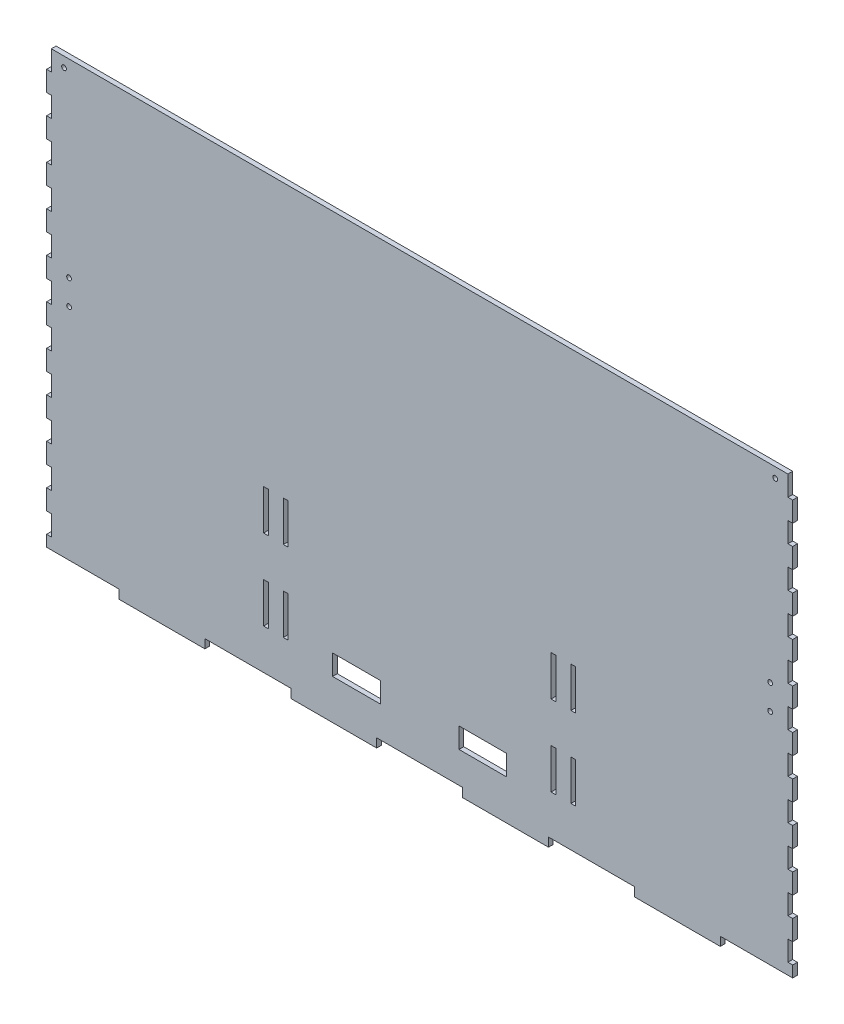
from build123d import *

# Parameters (mm, degrees)
SKETCH1_W                  = 2.9972
SKETCH1_H                  = 12.7
MAIN_EXTRUDE_DEPTH         = 2.9972
SKETCH8_R                  = 1.5
SKETCH8_W                  = 3.175
SKETCH8_H                  = 31.877
MOUNT_HOLES_DEPTH          = 430.751129385
SKETCH5_W                  = 2.9972
SKETCH5_H                  = 25.4
DOOR_GUIDE_SLOTS_DEPTH     = 430.751129385
SKETCH7_W                  = 30.1
SKETCH7_H                  = 12.85
LEVER_HOLES_DEPTH          = 430.751129385
SKETCH12_R                 = 1.5
EXTENSION_CLIP_HOLES_DEPTH = 430.751129385
EXTENSION_CENTER_CUT_DEPTH = 430.751129385


with BuildPart() as part:
    # Sketch1 → Main Extrude (new body)
    with BuildSketch(Plane.XY):
        Polygon((-380.8222, 139.7), (-406.4, 139.7), (-406.4, -139.7), (-352.213333333, -139.7), (-352.213333333, -134.112), (-298.026666667, -134.112), (-298.026666667, -139.7), (-243.84, -139.7), (-243.84, -134.112), (-189.653333333, -134.112), (-189.653333333, -139.7), (-135.466666667, -139.7), (-135.466666667, -134.112), (-81.28, -134.112), (-81.28, -139.7), (-27.093333333, -139.7), (-27.093333333, -134.112), (27.093333333, -134.112), (27.093333333, -139.7), (81.28, -139.7), (81.28, -134.112), (135.466666667, -134.112), (135.466666667, -139.7), (189.653333333, -139.7), (189.653333333, -134.112), (243.84, -134.112), (243.84, -139.7), (298.026666667, -139.7), (298.026666667, -134.112), (352.213333333, -134.112), (352.213333333, -139.7), (406.4, -139.7), (406.4, 139.7), (380.8222, 139.7), (380.8222, 127), (377.825, 127), (377.825, 139.7), (-377.825, 139.7), (-377.825, 127), (-380.8222, 127), align=None)
        with Locations((-379.3236, 107.95)):
            Rectangle(SKETCH1_W, SKETCH1_H, mode=Mode.SUBTRACT)
        with Locations((-379.3236, 82.55)):
            Rectangle(SKETCH1_W, SKETCH1_H, mode=Mode.SUBTRACT)
        with Locations((-379.3236, 57.15)):
            Rectangle(SKETCH1_W, SKETCH1_H, mode=Mode.SUBTRACT)
        with Locations((-379.3236, 31.75)):
            Rectangle(SKETCH1_W, SKETCH1_H, mode=Mode.SUBTRACT)
        with Locations((-379.3236, 6.35)):
            Rectangle(SKETCH1_W, SKETCH1_H, mode=Mode.SUBTRACT)
        with Locations((-379.3236, -19.05)):
            Rectangle(SKETCH1_W, SKETCH1_H, mode=Mode.SUBTRACT)
        with Locations((-379.3236, -44.45)):
            Rectangle(SKETCH1_W, SKETCH1_H, mode=Mode.SUBTRACT)
        with Locations((-379.3236, -69.85)):
            Rectangle(SKETCH1_W, SKETCH1_H, mode=Mode.SUBTRACT)
        with Locations((-379.3236, -95.25)):
            Rectangle(SKETCH1_W, SKETCH1_H, mode=Mode.SUBTRACT)
        with Locations((-379.3236, -120.65)):
            Rectangle(SKETCH1_W, SKETCH1_H, mode=Mode.SUBTRACT)
        with Locations((379.3236, 107.95)):
            Rectangle(SKETCH1_W, SKETCH1_H, mode=Mode.SUBTRACT)
        with Locations((379.3236, 82.55)):
            Rectangle(SKETCH1_W, SKETCH1_H, mode=Mode.SUBTRACT)
        with Locations((379.3236, 57.15)):
            Rectangle(SKETCH1_W, SKETCH1_H, mode=Mode.SUBTRACT)
        with Locations((379.3236, 31.75)):
            Rectangle(SKETCH1_W, SKETCH1_H, mode=Mode.SUBTRACT)
        with Locations((379.3236, 6.35)):
            Rectangle(SKETCH1_W, SKETCH1_H, mode=Mode.SUBTRACT)
        with Locations((379.3236, -19.05)):
            Rectangle(SKETCH1_W, SKETCH1_H, mode=Mode.SUBTRACT)
        with Locations((379.3236, -44.45)):
            Rectangle(SKETCH1_W, SKETCH1_H, mode=Mode.SUBTRACT)
        with Locations((379.3236, -69.85)):
            Rectangle(SKETCH1_W, SKETCH1_H, mode=Mode.SUBTRACT)
        with Locations((379.3236, -95.25)):
            Rectangle(SKETCH1_W, SKETCH1_H, mode=Mode.SUBTRACT)
        with Locations((379.3236, -120.65)):
            Rectangle(SKETCH1_W, SKETCH1_H, mode=Mode.SUBTRACT)
    extrude(amount=MAIN_EXTRUDE_DEPTH)

    # Sketch8 → Mount Holes (cut, through all)
    with BuildSketch(Plane.XY.offset(2.9972)):
        with Locations((-393.7, -120.65)):
            Circle(SKETCH8_R)
        with Locations((393.7, -120.65)):
            Circle(SKETCH8_R)
        with Locations((-382.4097, 12.319)):
            Rectangle(SKETCH8_W, SKETCH8_H)
        with Locations((382.4097, 12.319)):
            Rectangle(SKETCH8_W, SKETCH8_H)
    extrude(amount=-MOUNT_HOLES_DEPTH, mode=Mode.SUBTRACT)

    # Sketch5 → Door Guide Slots (cut, through all)
    with BuildSketch(Plane.XY.offset(2.9972)):
        with Locations((-96.9264, -96.012)):
            Rectangle(SKETCH5_W, SKETCH5_H)
        with Locations((-96.9264, -45.212)):
            Rectangle(SKETCH5_W, SKETCH5_H)
        with Locations((-84.4296, -96.012)):
            Rectangle(SKETCH5_W, SKETCH5_H)
        with Locations((-84.4296, -45.212)):
            Rectangle(SKETCH5_W, SKETCH5_H)
        with Locations((96.9264, -96.012)):
            Rectangle(SKETCH5_W, SKETCH5_H)
        with Locations((96.9264, -45.212)):
            Rectangle(SKETCH5_W, SKETCH5_H)
        with Locations((84.4296, -45.212)):
            Rectangle(SKETCH5_W, SKETCH5_H)
        with Locations((84.4296, -96.012)):
            Rectangle(SKETCH5_W, SKETCH5_H)
    extrude(amount=-DOOR_GUIDE_SLOTS_DEPTH, mode=Mode.SUBTRACT)

    # Sketch7 → Lever Holes (cut, through all)
    with BuildSketch(Plane.XY.offset(2.9972)):
        with Locations((-39.878, -108.067)):
            Rectangle(SKETCH7_W, SKETCH7_H)
        with Locations((39.878, -108.067)):
            Rectangle(SKETCH7_W, SKETCH7_H)
    extrude(amount=-LEVER_HOLES_DEPTH, mode=Mode.SUBTRACT)

    # Sketch12 → Extension Clip Holes (cut, through all)
    with BuildSketch(Plane.XY.offset(2.9972)):
        with Locations((-246.507, 20.193)):
            Circle(SKETCH12_R)
        with Locations((-246.507, 4.445)):
            Circle(SKETCH12_R)
        with Locations((-221.107, 4.445)):
            Circle(SKETCH12_R)
        with Locations((-221.107, 20.193)):
            Circle(SKETCH12_R)
        with Locations((-243.332, 133.35)):
            Circle(SKETCH12_R)
        with Locations((-224.282, 133.35)):
            Circle(SKETCH12_R)
        with Locations((224.282, 133.35)):
            Circle(SKETCH12_R)
        with Locations((243.332, 133.35)):
            Circle(SKETCH12_R)
        with Locations((221.107, 20.193)):
            Circle(SKETCH12_R)
        with Locations((221.107, 4.445)):
            Circle(SKETCH12_R)
        with Locations((246.507, 4.445)):
            Circle(SKETCH12_R)
        with Locations((246.507, 20.193)):
            Circle(SKETCH12_R)
    extrude(amount=-EXTENSION_CLIP_HOLES_DEPTH, mode=Mode.SUBTRACT)

    # Sketch11<3> → Extension Center Cut (cut, through all)
    with BuildSketch(Plane.XY.offset(2.9972)):
        Polygon((-232.3084, 127), (-232.3084, 139.7), (-406.4, 139.7), (-406.4, -139.7), (-235.3056, -139.7), (-235.3056, -127), (-232.3084, -127), (-232.3084, -114.3), (-235.3056, -114.3), (-235.3056, -101.6), (-232.3084, -101.6), (-232.3084, -88.9), (-235.3056, -88.9), (-235.3056, -76.2), (-232.3084, -76.2), (-232.3084, -63.5), (-235.3056, -63.5), (-235.3056, -50.8), (-232.3084, -50.8), (-232.3084, -38.1), (-235.3056, -38.1), (-235.3056, -25.4), (-232.3084, -25.4), (-232.3084, -12.7), (-235.3056, -12.7), (-235.3056, 0), (-232.3084, 0), (-232.3084, 12.7), (-235.3056, 12.7), (-235.3056, 25.4), (-232.3084, 25.4), (-232.3084, 38.1), (-235.3056, 38.1), (-235.3056, 50.8), (-232.3084, 50.8), (-232.3084, 63.5), (-235.3056, 63.5), (-235.3056, 76.2), (-232.3084, 76.2), (-232.3084, 88.9), (-235.3056, 88.9), (-235.3056, 101.6), (-232.3084, 101.6), (-232.3084, 114.3), (-235.3056, 114.3), (-235.3056, 127), align=None)
        Polygon((406.4, 139.7), (232.3084, 139.7), (232.3084, 127), (235.3056, 127), (235.3056, 114.3), (232.3084, 114.3), (232.3084, 101.6), (235.3056, 101.6), (235.3056, 88.9), (232.3084, 88.9), (232.3084, 76.2), (235.3056, 76.2), (235.3056, 63.5), (232.3084, 63.5), (232.3084, 50.8), (235.3056, 50.8), (235.3056, 38.1), (232.3084, 38.1), (232.3084, 25.4), (235.3056, 25.4), (235.3056, 12.7), (232.3084, 12.7), (232.3084, 0), (235.3056, 0), (235.3056, -12.7), (232.3084, -12.7), (232.3084, -25.4), (235.3056, -25.4), (235.3056, -38.1), (232.3084, -38.1), (232.3084, -50.8), (235.3056, -50.8), (235.3056, -63.5), (232.3084, -63.5), (232.3084, -76.2), (235.3056, -76.2), (235.3056, -88.9), (232.3084, -88.9), (232.3084, -101.6), (235.3056, -101.6), (235.3056, -114.3), (232.3084, -114.3), (232.3084, -127), (235.3056, -127), (235.3056, -139.7), (406.4, -139.7), align=None)
    extrude(amount=-EXTENSION_CENTER_CUT_DEPTH, mode=Mode.SUBTRACT)


solid = part.part
